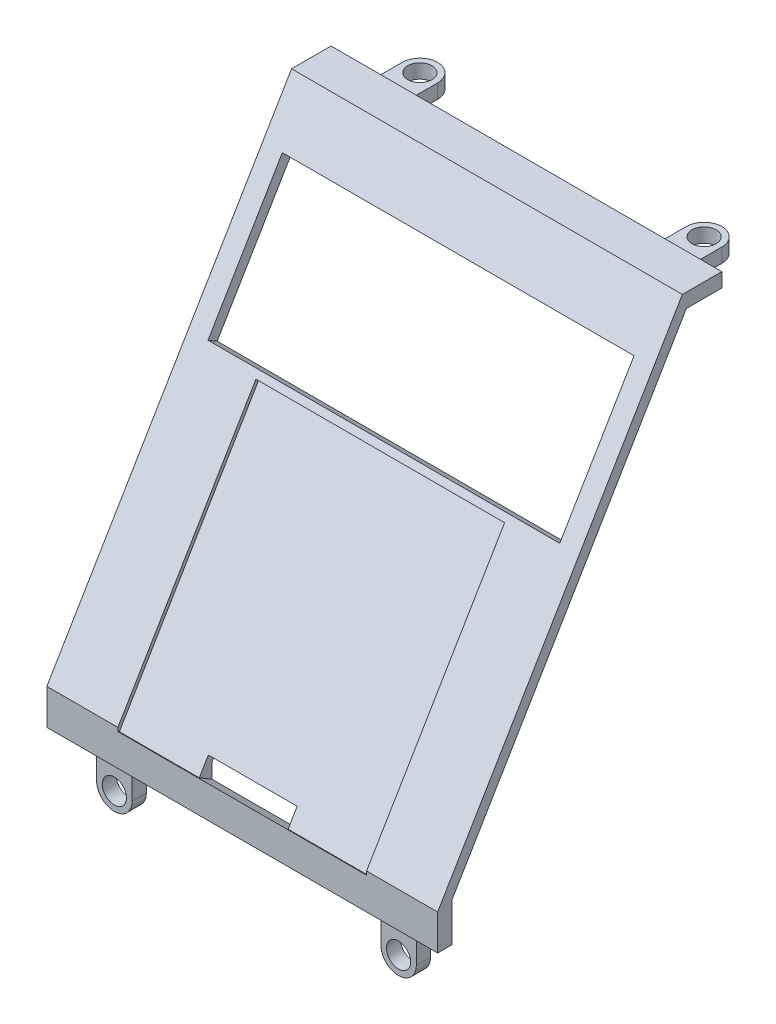
from build123d import *

# Parameters (mm, degrees)
BOSS_EXTRUDE1_DEPTH             = 55
CUT_EXTRUDE1_REACH              = 107.787
SKETCH3_W                       = 99
SKETCH3_H                       = 41
SKETCH4_W                       = 70
SKETCH4_H                       = 77
CUT_EXTRUDE2_DEPTH              = 1
SKETCH5_R                       = 4
SKETCH5_R_2                     = 1.5
BOSS_EXTRUDE2_DEPTH             = 3
SKETCH6_W                       = 10
SKETCH6_H                       = 4
BOSS_EXTRUDE3_DEPTH             = 15
BOSS_EXTRUDE3_DIRECTION_2_REACH = 124.058
CUT_EXTRUDE3_REACH              = 142.321
SKETCH7_R                       = 3.41
FILLET1_R                       = 3
FILLET2_R                       = 5
CUT_EXTRUDE4_REACH              = 112.137
SKETCH8_W                       = 25
SKETCH8_H                       = 5
SKETCH9_W                       = 10
SKETCH9_H                       = 4
BOSS_EXTRUDE4_DEPTH             = 15
BOSS_EXTRUDE4_DIRECTION_2_REACH = 149.117
CUT_EXTRUDE5_REACH              = 138.058
SKETCH10_R                      = 3.41
FILLET3_R                       = 3
FILLET4_R                       = 5


with BuildPart() as part:
    # Sketch2 → Boss-Extrude1 (new, symmetric)
    with BuildSketch(Plane(origin=(0, 0, 0), x_dir=(0, 0, -1), z_dir=(1, 0, 0))):
        Polygon((-52.121320344, -63.981493427), (16.76363182, 52.121320344), (27.878679656, 52.121320344), (27.878679656, 48.121320344), (17.878679656, 48.121320344), (-48.121320344, -63.119022696), (-48.121320344, -73.981493427), (-52.121320344, -73.981493427), align=None)
    extrude(amount=BOSS_EXTRUDE1_DEPTH, both=True)

    # Sketch3 → Cut-Extrude1 (cut, up to next)
    with BuildSketch(Plane(origin=(0, 6.214083509, 10.473587595), x_dir=(1, 0, 0), z_dir=(0, 0.5102589049122125, 0.8600208427461452)), mode=Mode.PRIVATE) as cut_extrude1_sk1:
        with Locations((0, 17.008093979)):
            Rectangle(SKETCH3_W, SKETCH3_H)
    cut_extrude1_tool1 = extrude(cut_extrude1_sk1.sketch, amount=-CUT_EXTRUDE1_REACH, mode=Mode.PRIVATE) & part.part
    add(cut_extrude1_tool1.solids().sort_by_distance((0, 20.841399, 1.795056))[0], mode=Mode.SUBTRACT)

    # Sketch4 → Cut-Extrude2 (cut)
    with BuildSketch(Plane(origin=(0, 6.214083509, 10.473587595), x_dir=(1, 0, 0), z_dir=(0, 0.5102589049122125, 0.8600208427461452))):
        with Locations((0, -43.991906021)):
            Rectangle(SKETCH4_W, SKETCH4_H)
    extrude(amount=-CUT_EXTRUDE2_DEPTH, mode=Mode.SUBTRACT)

    # Sketch5 → Boss-Extrude2 (add)
    # profile 1 of 4: a face of its own
    with BuildSketch(Plane(origin=(0, 4.683306794, 7.893525066), x_dir=(-1, 0, 0), z_dir=(0, -0.5102589049122127, -0.8600208427461451))):
        with Locations(Location((-46.5, 44.408093979, 0), (0, 0, 270))):
            Circle(SKETCH5_R)
        with Locations(Location((-46.5, 44.408093979, 0), (0, 0, 270))):
            Circle(SKETCH5_R_2, mode=Mode.SUBTRACT)
    # profile 2 of 4: a face of its own
    with BuildSketch(Plane(origin=(0, 4.683306794, 7.893525066), x_dir=(-1, 0, 0), z_dir=(0, -0.5102589049122127, -0.8600208427461451))):
        with Locations(Location((-46.5, -10.391906021, 0), (0, 0, 270))):
            Circle(SKETCH5_R)
        with Locations(Location((-46.5, -10.391906021, 0), (0, 0, 270))):
            Circle(SKETCH5_R_2, mode=Mode.SUBTRACT)
    # profile 3 of 4: a face of its own
    with BuildSketch(Plane(origin=(0, 4.683306794, 7.893525066), x_dir=(-1, 0, 0), z_dir=(0, -0.5102589049122127, -0.8600208427461451))):
        with Locations(Location((46.5, -10.391906021, 0), (0, 0, 270))):
            Circle(SKETCH5_R)
        with Locations(Location((46.5, -10.391906021, 0), (0, 0, 270))):
            Circle(SKETCH5_R_2, mode=Mode.SUBTRACT)
    # profile 4 of 4: a face of its own
    with BuildSketch(Plane(origin=(0, 4.683306794, 7.893525066), x_dir=(-1, 0, 0), z_dir=(0, -0.5102589049122127, -0.8600208427461451))):
        with Locations(Location((46.5, 44.408093979, 0), (0, 0, 270))):
            Circle(SKETCH5_R)
        with Locations(Location((46.5, 44.408093979, 0), (0, 0, 270))):
            Circle(SKETCH5_R_2, mode=Mode.SUBTRACT)
    extrude(amount=BOSS_EXTRUDE2_DEPTH)

    # Sketch6 → Boss-Extrude3 (add)
    with BuildSketch(Plane(origin=(0, 0, -27.878679656), x_dir=(-1, 0, 0), z_dir=(0, 0, -1))):
        with Locations((40, 46.121320344)):
            Rectangle(SKETCH6_W, SKETCH6_H)
        with Locations((-40, 46.121320344)):
            Rectangle(SKETCH6_W, SKETCH6_H)
    extrude(amount=BOSS_EXTRUDE3_DEPTH)

    # Sketch6 → Boss-Extrude3 direction 2 (add, up to next)
    with BuildSketch(Plane(origin=(0, 0, -27.878679656), x_dir=(-1, 0, 0), z_dir=(0, 0, -1)), mode=Mode.PRIVATE) as boss_extrude3_direction_2_sk1:
        with Locations((40, 46.121320344)):
            Rectangle(SKETCH6_W, SKETCH6_H)
    boss_extrude3_direction_2_tool1 = extrude(boss_extrude3_direction_2_sk1.sketch, amount=-BOSS_EXTRUDE3_DIRECTION_2_REACH, mode=Mode.PRIVATE) - part.part
    # Sketch6 → Boss-Extrude3 direction 2 (add, up to next)
    with BuildSketch(Plane(origin=(0, 0, -27.878679656), x_dir=(-1, 0, 0), z_dir=(0, 0, -1)), mode=Mode.PRIVATE) as boss_extrude3_direction_2_sk2:
        with Locations((-40, 46.121320344)):
            Rectangle(SKETCH6_W, SKETCH6_H)
    boss_extrude3_direction_2_tool2 = extrude(boss_extrude3_direction_2_sk2.sketch, amount=-BOSS_EXTRUDE3_DIRECTION_2_REACH, mode=Mode.PRIVATE) - part.part
    add(boss_extrude3_direction_2_tool1.solids().sort_by_distance((-40, 46.12132, -27.87868))[0])
    add(boss_extrude3_direction_2_tool2.solids().sort_by_distance((40, 46.12132, -27.87868))[0])

    # Sketch7 → Cut-Extrude3 (cut, up to next)
    with BuildSketch(Plane.XZ.offset(-44.121320344), mode=Mode.PRIVATE) as cut_extrude3_sk1:
        with Locations(Location((-40, -37.878679656, 0), (0, 0, 270))):
            Circle(SKETCH7_R)
    cut_extrude3_tool1 = extrude(cut_extrude3_sk1.sketch, amount=-CUT_EXTRUDE3_REACH, mode=Mode.PRIVATE) & part.part
    # Sketch7 → Cut-Extrude3 (cut, up to next)
    with BuildSketch(Plane.XZ.offset(-44.121320344), mode=Mode.PRIVATE) as cut_extrude3_sk2:
        with Locations(Location((40, -37.878679656, 0), (0, 0, 270))):
            Circle(SKETCH7_R)
    cut_extrude3_tool2 = extrude(cut_extrude3_sk2.sketch, amount=-CUT_EXTRUDE3_REACH, mode=Mode.PRIVATE) & part.part
    add(cut_extrude3_tool1.solids().sort_by_distance((-40, 44.12132, -37.87868))[0], mode=Mode.SUBTRACT)
    add(cut_extrude3_tool2.solids().sort_by_distance((40, 44.12132, -37.87868))[0], mode=Mode.SUBTRACT)

    # Fillet1
    fillet1_edges = [part.edges().sort_by_distance(p)[0] for p in [
        (-35, 46.121320344, -16.692059799),
        (35, 46.121320344, -16.692059799),
        (45, 48.121320344, -22.878679656),
        (35, 48.121320344, -22.878679656),
        (38.885828328, 44.121320344, -15.505439942),
        (-38.885828328, 44.121320344, -15.505439942),
        (-45, 48.121320344, -22.878679656),
        (-35, 48.121320344, -22.878679656),
    ]]
    fillet(fillet1_edges, radius=FILLET1_R)

    # Fillet2
    fillet2_edges = [part.edges().sort_by_distance(p)[0] for p in [
        (45, 46.121320344, -42.878679656),
        (35, 46.121320344, -42.878679656),
        (-35, 46.121320344, -42.878679656),
        (-45, 46.121320344, -42.878679656),
    ]]
    fillet(fillet2_edges, radius=FILLET2_R - 0.0001)  # a hair under: the kernel refuses the full size

    # Sketch8 → Cut-Extrude4 (cut, up to next)
    with BuildSketch(Plane(origin=(0, 5.703824604, 9.613566752), x_dir=(1, 0, 0), z_dir=(0, 0.5102589049122124, 0.8600208427461452)), mode=Mode.PRIVATE) as cut_extrude4_sk1:
        with Locations((0, -79.991906021)):
            Rectangle(SKETCH8_W, SKETCH8_H)
    cut_extrude4_tool1 = extrude(cut_extrude4_sk1.sketch, amount=-CUT_EXTRUDE4_REACH, mode=Mode.PRIVATE) & part.part
    add(cut_extrude4_tool1.solids().sort_by_distance((0, -63.090882, 50.430149))[0], mode=Mode.SUBTRACT)

    # Sketch9 → Boss-Extrude4 (add)
    with BuildSketch(Plane.XZ.offset(73.981493427)):
        with Locations((-40, 46.121320344)):
            Rectangle(SKETCH9_W, SKETCH9_H)
        with Locations((40, 46.121320344)):
            Rectangle(SKETCH9_W, SKETCH9_H)
    extrude(amount=BOSS_EXTRUDE4_DEPTH)

    # Boss-Extrude4 direction 2: up to this plane
    boss_extrude4_direction_2_end = Plane(origin=(55, 48.121320344, -17.878679656), z_dir=(0, 0.5102589049122126, 0.8600208427461451))
    # Sketch9 → Boss-Extrude4 direction 2 (add, up to the surface)
    with BuildSketch(Plane.XZ.offset(73.981493427), mode=Mode.PRIVATE) as boss_extrude4_direction_2_sk1:
        with Locations((-40, 46.121320344)):
            Rectangle(SKETCH9_W, SKETCH9_H)
    boss_extrude4_direction_2_tool1 = split(extrude(boss_extrude4_direction_2_sk1.sketch, amount=-BOSS_EXTRUDE4_DIRECTION_2_REACH, mode=Mode.PRIVATE), bisect_by=boss_extrude4_direction_2_end, keep=Keep.BOTH, mode=Mode.PRIVATE)
    add(boss_extrude4_direction_2_tool1.solids().sort_by_distance((-40, -73.981493, 46.12132))[0])
    # Sketch9 → Boss-Extrude4 direction 2 (add, up to the surface)
    with BuildSketch(Plane.XZ.offset(73.981493427), mode=Mode.PRIVATE) as boss_extrude4_direction_2_sk2:
        with Locations((40, 46.121320344)):
            Rectangle(SKETCH9_W, SKETCH9_H)
    boss_extrude4_direction_2_tool2 = split(extrude(boss_extrude4_direction_2_sk2.sketch, amount=-BOSS_EXTRUDE4_DIRECTION_2_REACH, mode=Mode.PRIVATE), bisect_by=boss_extrude4_direction_2_end, keep=Keep.BOTH, mode=Mode.PRIVATE)
    add(boss_extrude4_direction_2_tool2.solids().sort_by_distance((40, -73.981493, 46.12132))[0])

    # Sketch10 → Cut-Extrude5 (cut, up to next)
    with BuildSketch(Plane(origin=(0, 0, 44.121320344), x_dir=(-1, 0, 0), z_dir=(0, 0, -1)), mode=Mode.PRIVATE) as cut_extrude5_sk1:
        with Locations((40, -83.981493427)):
            Circle(SKETCH10_R)
    cut_extrude5_tool1 = extrude(cut_extrude5_sk1.sketch, amount=-CUT_EXTRUDE5_REACH, mode=Mode.PRIVATE) & part.part
    # Sketch10 → Cut-Extrude5 (cut, up to next)
    with BuildSketch(Plane(origin=(0, 0, 44.121320344), x_dir=(-1, 0, 0), z_dir=(0, 0, -1)), mode=Mode.PRIVATE) as cut_extrude5_sk2:
        with Locations(Location((-40, -83.981493427, 0), (0, 0, 180))):
            Circle(SKETCH10_R)
    cut_extrude5_tool2 = extrude(cut_extrude5_sk2.sketch, amount=-CUT_EXTRUDE5_REACH, mode=Mode.PRIVATE) & part.part
    add(cut_extrude5_tool1.solids().sort_by_distance((-40, -83.981493, 44.12132))[0], mode=Mode.SUBTRACT)
    add(cut_extrude5_tool2.solids().sort_by_distance((40, -83.981493, 44.12132))[0], mode=Mode.SUBTRACT)

    # Fillet3
    fillet3_edges = [part.edges().sort_by_distance(p)[0] for p in [
        (-45, -68.550258061, 48.121320344),
        (-35, -59.74810321, 46.121320344),
        (-35, -68.550258061, 48.121320344),
        (-40, -56.377183724, 44.121320344),
        (-45, -59.74810321, 46.121320344),
        (35, -68.550258061, 48.121320344),
        (45, -59.74810321, 46.121320344),
        (45, -68.550258061, 48.121320344),
        (40, -56.377183724, 44.121320344),
        (35, -59.74810321, 46.121320344),
    ]]
    fillet(fillet3_edges, radius=FILLET3_R)

    # Fillet4
    fillet4_edges = [part.edges().sort_by_distance(p)[0] for p in [
        (-45, -88.981493427, 46.121320344),
        (-35, -88.981493427, 46.121320344),
        (35, -88.981493427, 46.121320344),
        (45, -88.981493427, 46.121320344),
    ]]
    fillet(fillet4_edges, radius=FILLET4_R - 0.0001)  # a hair under: the kernel refuses the full size


solid = part.part
